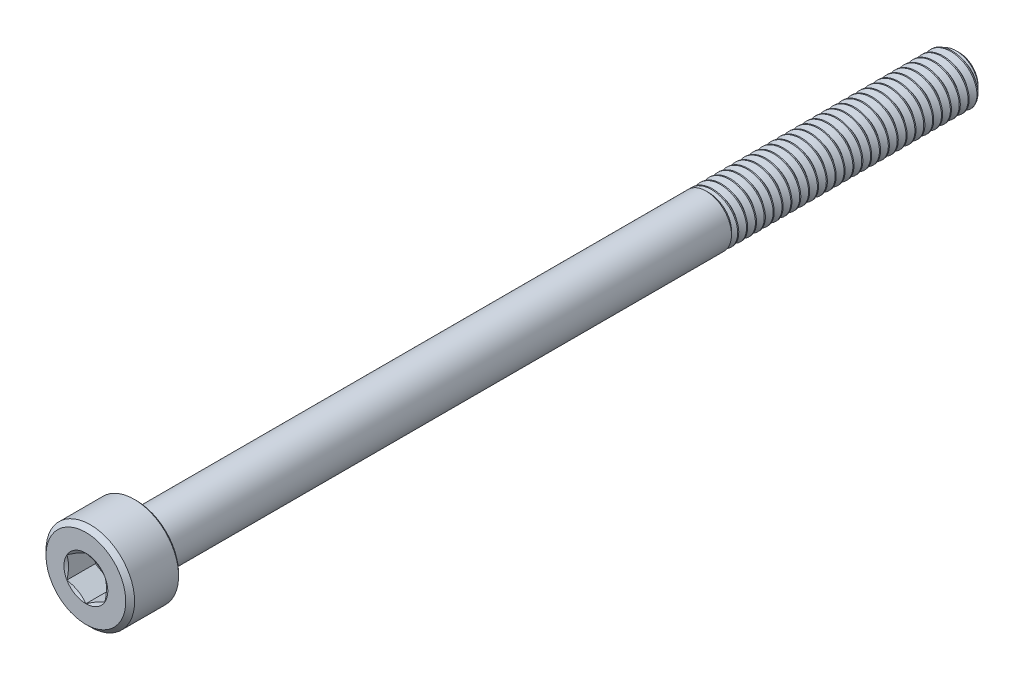
from build123d import *

# Parameters (mm, degrees)
CUT_EXTRUDE1_DEPTH            = 2.25
CHAMFER1_SIZE                 = 0.35
CHAMFER2_SIZE                 = 0.175
CUT_SWEEP1_PITCH              = 0.7
SKETCH9_R                     = 3.325
BOSS_EXTRUDE2_DEPTH           = 1.75
BOSS_EXTRUDE1_START           = 45
SKETCH8_R                     = 2
BOSS_EXTRUDE1_DEPTH           = 46.75
BOSS_EXTRUDE1_OTHER_WAY_DEPTH = 0.7
BOSS_EXTRUDE1_OTHER_WAY_TAPER = 45


with BuildPart() as part:
    # Sketch2 → Revolve1 (revolve)
    with BuildSketch(Plane(origin=(0, 0, 0), x_dir=(0, 0, -1), z_dir=(1, 0, 0)), mode=Mode.PRIVATE) as revolve1_sk:
        Polygon((34.5, 1.475), (33.975, 2), (-30.5, 2), (-30.5, 3.5), (-34.5, 3.5), (-34.5, 0), (34.5, 0), align=None)
    revolve(revolve1_sk.sketch.rotate(Axis((0, 0, -34.5), (0, 0, 1)), 90), axis=Axis((0, 0, -34.5), (0, 0, 1)))

    # Sketch4 → Cut-Extrude1 (cut)
    with BuildSketch(Plane.XY.offset(34.5)):
        Polygon((0, 1.732050808), (-1.5, 0.866025404), (-1.5, -0.866025404), (0, -1.732050808), (1.5, -0.866025404), (1.5, 0.866025404), align=None)
    extrude(amount=-CUT_EXTRUDE1_DEPTH, mode=Mode.SUBTRACT)

    # Cut-Extrude2 cone 1 section (through the dimple's axis) → Cut-Extrude2 (revolve, cut)
    with BuildSketch(Plane(origin=(0, 0, 34.5), x_dir=(0, -1, 0), z_dir=(1, 0, 0))):
        Polygon((0, 0), (1.732050808, 0), (0, 1), align=None)
    revolve(axis=Axis((0, 0, 34.5), (0, 0, -1)), mode=Mode.SUBTRACT)

    # Chamfer1
    chamfer1_edges = [part.edges().sort_by_distance(p)[0] for p in [
        (3.5, 0, 34.5),
    ]]
    chamfer(chamfer1_edges, length=CHAMFER1_SIZE)

    # Chamfer2
    chamfer2_edges = [part.edges().sort_by_distance(p)[0] for p in [
        (3.5, 0, 30.5),
    ]]
    chamfer(chamfer2_edges, length=CHAMFER2_SIZE)

    # Cut-Sweep1: the profile of Sketch7 screwed along a right-hand helix of 29.571429 turns, 6 arcs to a turn; built about Z, then put on its axis
    cut_sweep1_z = Axis((0, 0, 0), (0, 0, 1))
    cut_sweep1_corners = [(1.545336663, 0, -0.2625), (1.545336663, 0, -0.35), (2.037888611, 0, -0.634375), (2.037888611, 0, 0.021875)]
    with BuildLine(mode=Mode.PRIVATE) as cut_sweep1_profile:
        Line(cut_sweep1_corners[0], cut_sweep1_corners[1])
        Line(cut_sweep1_corners[1], cut_sweep1_corners[2])
        Line(cut_sweep1_corners[2], cut_sweep1_corners[3])
        Line(cut_sweep1_corners[3], cut_sweep1_corners[0])
    cut_sweep1_cap = Face(cut_sweep1_profile.wire())
    cut_sweep1_turn_angles = [0, 30, 60, 90, 120, 150, 180, 210, 240, 270, 300, 330, 360]
    cut_sweep1_turn_weights = [1, 0.8660254037844387, 1, 0.8660254037844387, 1, 0.8660254037844387, 1, 0.8660254037844387, 1, 0.8660254037844387, 1, 0.8660254037844387, 1]
    cut_sweep1_turn_rails = [Edge.make_bspline([Vector(p[0], p[1], 0).rotate(cut_sweep1_z, cut_sweep1_turn_angles[k]) / cut_sweep1_turn_weights[k] + Vector(0, 0, p[2] + CUT_SWEEP1_PITCH * cut_sweep1_turn_angles[k] / 360) for k in range(13)], [0, 0, 0, 1, 1, 2, 2, 3, 3, 4, 4, 5, 5, 6, 6, 6], 2, cut_sweep1_turn_weights) for p in cut_sweep1_corners]
    cut_sweep1_turn_sides = [Face.make_surface_from_curves(cut_sweep1_turn_rails[p[0]], cut_sweep1_turn_rails[p[1]]) for p in [(0, 1), (1, 2), (2, 3), (3, 0)]]
    cut_sweep1_last_angles = [10440, 10470, 10500, 10530, 10560, 10590, 10620, 10632.857142857, 10645.714285714]
    cut_sweep1_last_weights = [1, 0.8660254037844387, 1, 0.8660254037844387, 1, 0.8660254037844387, 1, 0.9749279121817519, 1]
    cut_sweep1_last_rails = [Edge.make_bspline([Vector(p[0], p[1], 0).rotate(cut_sweep1_z, cut_sweep1_last_angles[k]) / cut_sweep1_last_weights[k] + Vector(0, 0, p[2] + CUT_SWEEP1_PITCH * cut_sweep1_last_angles[k] / 360) for k in range(9)], [0, 0, 0, 1, 1, 2, 2, 3, 3, 4, 4, 4], 2, cut_sweep1_last_weights) for p in cut_sweep1_corners]
    cut_sweep1_last_sides = [Face.make_surface_from_curves(cut_sweep1_last_rails[p[0]], cut_sweep1_last_rails[p[1]]) for p in [(0, 1), (1, 2), (2, 3), (3, 0)]]
    cut_sweep1 = Plane(origin=(0, 0, -34.5), x_dir=(0, 1, 0), z_dir=(0, 0, 1)) * Solid(Shell([*[p.moved(Location((0, 0, CUT_SWEEP1_PITCH * i))) for i in range(29) for p in cut_sweep1_turn_sides], *cut_sweep1_last_sides, cut_sweep1_cap, cut_sweep1_cap.rotate(cut_sweep1_z, 10645.714285714).moved(Location((0, 0, CUT_SWEEP1_PITCH * 10645.714285714 / 360)))]))
    add(cut_sweep1, mode=Mode.SUBTRACT)

    # Sketch9 → Boss-Extrude2 (add)
    with BuildSketch(Plane(origin=(0, 0, 30.5), x_dir=(-1, 0, 0), z_dir=(0, 0, -1))):
        Circle(SKETCH9_R)
    extrude(amount=-BOSS_EXTRUDE2_DEPTH)

    # Sketch8 → Boss-Extrude1 (add)
    with BuildSketch(Plane(origin=(0, 0, 30.5), x_dir=(-1, 0, 0), z_dir=(0, 0, -1)).offset(BOSS_EXTRUDE1_START)):
        Circle(SKETCH8_R)
    extrude(amount=-BOSS_EXTRUDE1_DEPTH)

    # Sketch8 → Boss-Extrude1 other way (add)
    with BuildSketch(Plane(origin=(0, 0, 30.5), x_dir=(-1, 0, 0), z_dir=(0, 0, -1)).offset(BOSS_EXTRUDE1_START)):
        Circle(SKETCH8_R)
    extrude(amount=BOSS_EXTRUDE1_OTHER_WAY_DEPTH, taper=BOSS_EXTRUDE1_OTHER_WAY_TAPER)


solid = part.part
